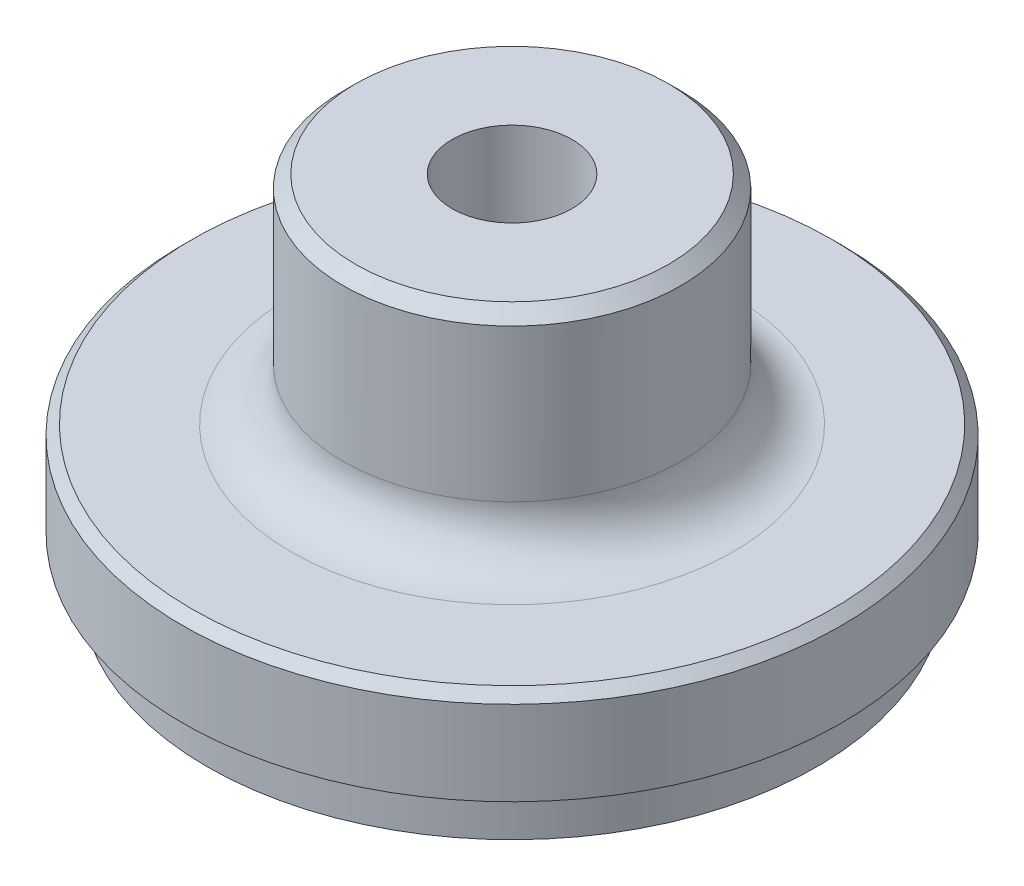
from build123d import *

# Parameters (mm, degrees)
SKETCH1_R           = 32.15
BOSS_EXTRUDE1_DEPTH = 5.3
SKETCH2_R           = 34.75
BOSS_EXTRUDE2_DEPTH = 9.9
SKETCH3_R           = 17.8
BOSS_EXTRUDE3_DEPTH = 22.85
SKETCH4_R           = 6.325
CUT_EXTRUDE1_DEPTH  = 25.4
FILLET1_R           = 5.5
CHAMFER2_SIZE       = 1


with BuildPart() as part:
    # Sketch1 → Boss-Extrude1 (new body)
    with BuildSketch(Plane(origin=(0, 0, 0), x_dir=(1, 0, 0), z_dir=(0, 1, 0))):
        with Locations(Location((0, 0, 0), (0, 0, 270))):
            Circle(SKETCH1_R)
    extrude(amount=BOSS_EXTRUDE1_DEPTH)

    # Sketch2 → Boss-Extrude2 (add)
    with BuildSketch(Plane(origin=(0, 5.3, 0), x_dir=(1, 0, 0), z_dir=(0, 1, 0))):
        with Locations(Location((0, 0, 0), (0, 0, 90))):
            Circle(SKETCH2_R)
    extrude(amount=BOSS_EXTRUDE2_DEPTH)

    # Sketch3 → Boss-Extrude3 (add)
    with BuildSketch(Plane(origin=(0, 15.2, 0), x_dir=(1, 0, 0), z_dir=(0, 1, 0))):
        with Locations(Location((0, 0, 0), (0, 0, 90))):
            Circle(SKETCH3_R)
    extrude(amount=BOSS_EXTRUDE3_DEPTH)

    # Sketch4 → Cut-Extrude1 (cut)
    with BuildSketch(Plane(origin=(0, 38.05, 0), x_dir=(1, 0, 0), z_dir=(0, 1, 0))):
        with Locations(Location((0, 0, 0), (0, 0, 270))):
            Circle(SKETCH4_R)
    extrude(amount=-CUT_EXTRUDE1_DEPTH, mode=Mode.SUBTRACT)

    # Fillet1
    fillet1_edges = [part.edges().sort_by_distance(p)[0] for p in [
        (0, 15.2, 17.8),
    ]]
    fillet(fillet1_edges, radius=FILLET1_R)

    # Chamfer1: read off the stored shape, not the designer's step
    # Chamfer1 outline → Chamfer1 (revolve, cut)
    with BuildSketch(Plane.XY):
        Polygon((17.8, 38.05), (16.5, 38.05), (17.8, 36.75), align=None)
    revolve(axis=Axis((0, 0, 0), (0, 1, 0)), mode=Mode.SUBTRACT)

    # Chamfer2
    chamfer2_edges = [part.edges().sort_by_distance(p)[0] for p in [
        (0, 15.2, 34.75),
    ]]
    chamfer(chamfer2_edges, length=CHAMFER2_SIZE)


solid = part.part
